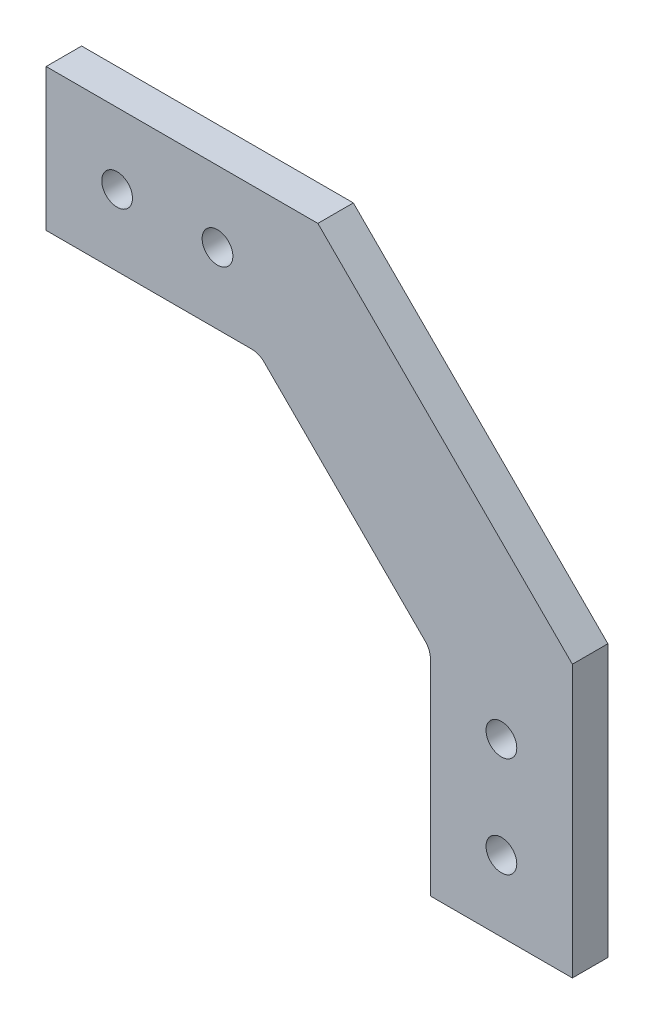
from build123d import *

# Parameters (mm, degrees)
BOSS_EXTRUDE1_DEPTH      = 6.35
FILLET1_R                = 3.175
M5_CLEARANCE_HOLE1_D     = 5.5
M5_CLEARANCE_HOLE1_DEPTH = 18.75
M5_CLEARANCE_HOLE1_TIP   = 1.652366702


with BuildPart() as part:
    # Sketch1 → Boss-Extrude1 (new body)
    with BuildSketch(Plane.XY):
        Polygon((-12.7, 29.029487758), (-12.7, 58.239487758), (-43.360512242, 88.9), (-81.460512242, 88.9), (-81.460512242, 114.3), (-32.839487758, 114.3), (12.7, 68.760512242), (12.7, 37.919487758), (12.7, 29.029487758), (12.7, 20.139487758), (-12.7, 20.139487758), align=None)
    extrude(amount=BOSS_EXTRUDE1_DEPTH)

    # Fillet1
    fillet1_edges = [part.edges().sort_by_distance(p)[0] for p in [
        (-43.360512242, 88.9, 3.175),
        (-12.7, 58.239487758, 3.175),
    ]]
    fillet(fillet1_edges, radius=FILLET1_R)

    # M5 Clearance Hole1
    with Locations(Plane.XY.offset(6.35)):
        with Locations((0, 50.8), (-50.8, 101.6), (-68.760512242, 101.6), (0, 32.839487758)):
            Hole(M5_CLEARANCE_HOLE1_D / 2, depth=M5_CLEARANCE_HOLE1_DEPTH)
            with Locations((0, 0, -(M5_CLEARANCE_HOLE1_DEPTH + M5_CLEARANCE_HOLE1_TIP / 2))):  # 118° drill point
                Cone(0, M5_CLEARANCE_HOLE1_D / 2, M5_CLEARANCE_HOLE1_TIP, mode=Mode.SUBTRACT)


solid = part.part
